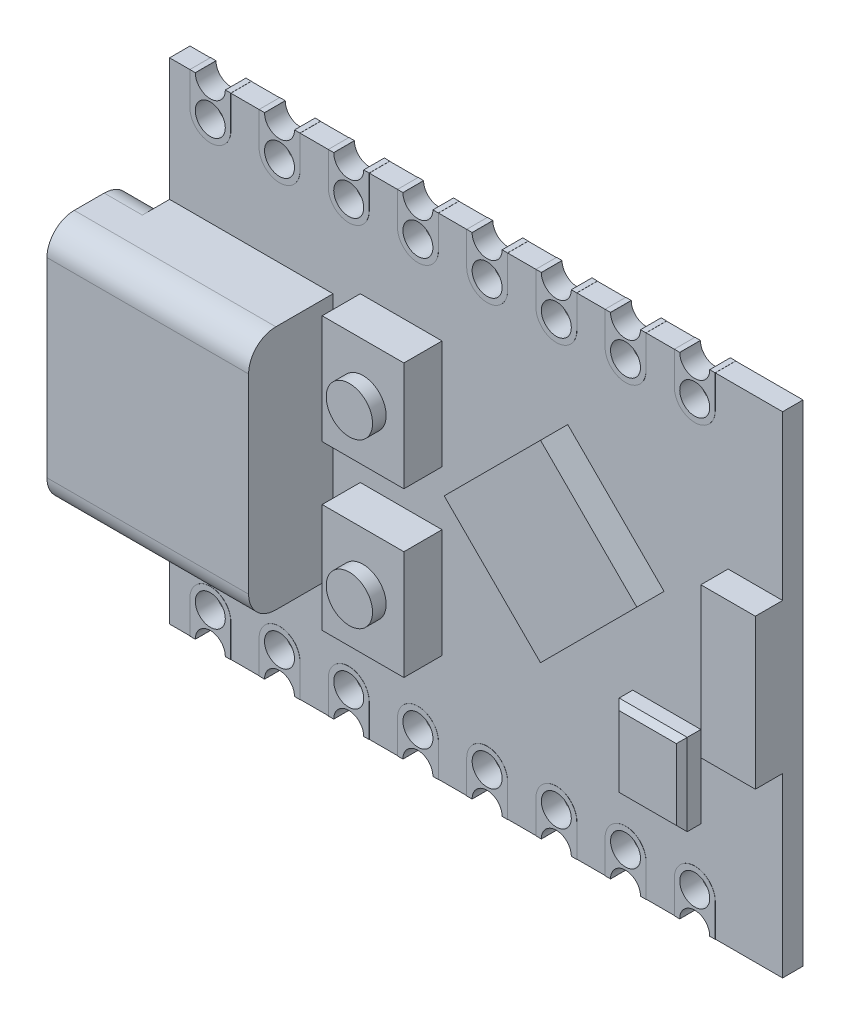
from build123d import *
from build123d.topology import SkipClean

# Parameters (mm, degrees)
ESBO_O1_W                     = 22.5
ESBO_O1_H                     = 18
PCI_DEPTH                     = 0.75
ESP32_DEPTH                   = 1
ESBO_O3_W                     = 7.4
ESBO_O3_H                     = 9
USB_C_DEPTH                   = 3.1
ARREDONDAMENTO_INFERIOR_USB_R = 1
ARREDONDAMENTO_SUPERIOR_USB_R = 1
FURO_USB_DEPTH                = 3.1
CONEXAOUSB_REACH              = 32.667
CONEXAOUSB_START              = -0.5
ESBO_O9_W                     = 0.75
ESBO_O9_H                     = 7.2
ESBO_O10_R                    = 0.55
FUROSPCB_DEPTH                = 0.75
PADS_START                    = 0.005
ESBO_O11_R                    = 0.55
PADS_DEPTH                    = 0.005
ESBO_O13_R                    = 0.55
INFERIORPADS_DEPTH            = 0.005
ESBO_O14_W                    = 0.2
ESBO_O14_H                    = 0.76
PADEX_DEPTH                   = 0.005
ESBO_O16_W                    = 0.2
ESBO_O16_H                    = 0.76
PADEX1_DEPTH                  = 0.005
ESBO_O17_W                    = 2
ESBO_O17_H                    = 5.5
ANTENA_DEPTH                  = 1
ESBO_O18_W                    = 3
ESBO_O18_H                    = 4
BUTTONS_DEPTH                 = 1.4
ESBO_O19_R                    = 0.85
RESSALTO_EXTRUS_O12_DEPTH     = 0.5
ESBO_O20_W                    = 2.5
ESBO_O20_H                    = 3
RESSALTO_EXTRUS_O13_DEPTH     = 0.7
CHANFRO1_SIZE                 = 0.2


with BuildPart() as part:
    # Esboço1 → PCI (new body)
    with BuildSketch(Plane.XY):
        with Locations((-11.25, 9)):
            Rectangle(ESBO_O1_W, ESBO_O1_H)
    extrude(amount=PCI_DEPTH)

    # Esboço2 → ESP32 (add)
    with BuildSketch(Plane.XY.offset(0.75)):
        Polygon((-11.421067812, 10.114466094), (-7.885533906, 13.65), (-4.35, 10.114466094), (-7.885533906, 6.578932188), align=None)
    extrude(amount=ESP32_DEPTH)

    # Esboço3 → USB-C (add)
    with BuildSketch(Plane.XY.offset(0.75)):
        with Locations((-20.2, 9)):
            Rectangle(ESBO_O3_W, ESBO_O3_H)
    extrude(amount=USB_C_DEPTH)

    # Arredondamento inferior USB
    arredondamento_inferior_usb_edges = [part.edges().sort_by_distance(p)[0] for p in [
        (-23.2, 13.5, 0.75),
        (-23.2, 4.5, 0.75),
    ]]
    fillet(arredondamento_inferior_usb_edges, radius=ARREDONDAMENTO_INFERIOR_USB_R)

    # Arredondamento Superior USB
    arredondamento_superior_usb_edges = [part.edges().sort_by_distance(p)[0] for p in [
        (-20.2, 13.5, 3.85),
        (-20.2, 4.5, 3.85),
    ]]
    fillet(arredondamento_superior_usb_edges, radius=ARREDONDAMENTO_SUPERIOR_USB_R)

    # Esboço8 → Furo USB (cut)
    with BuildSketch(Plane.ZY.offset(23.9)):
        with BuildLine():
            Line((1.05, 12.5), (1.05, 5.5))
            ThreePointArc((1.05, 5.5), (1.255025253, 5.005025253), (1.75, 4.8))
            Line((1.75, 4.8), (2.85, 4.8))
            ThreePointArc((2.85, 4.8), (3.344974747, 5.005025253), (3.55, 5.5))
            Line((3.55, 5.5), (3.55, 12.5))
            ThreePointArc((3.55, 12.5), (3.344974747, 12.994974747), (2.85, 13.2))
            Line((2.85, 13.2), (1.75, 13.2))
            ThreePointArc((1.75, 13.2), (1.255025253, 12.994974747), (1.05, 12.5))
        make_face()
    extrude(amount=-FURO_USB_DEPTH, mode=Mode.SUBTRACT)

    # Esboço9 → ConexaoUSB (add, up to next)
    with BuildSketch(Plane.ZY.offset(23.9).offset(CONEXAOUSB_START), mode=Mode.PRIVATE) as conexaousb_sk1:
        with Locations((2.3, 9)):
            Rectangle(ESBO_O9_W, ESBO_O9_H)
    conexaousb_tool1 = extrude(conexaousb_sk1.sketch, amount=-CONEXAOUSB_REACH, mode=Mode.PRIVATE) - part.part
    add(conexaousb_tool1.solids().sort_by_distance((-23.4, 9, 2.3))[0])

    # Esboço10 → FurosPCB (cut)
    with BuildSketch(Plane.XY.offset(0.75)):
        with Locations((-21, 1.2)):
            Circle(ESBO_O10_R)
        with Locations((-21, 0)):
            Circle(ESBO_O10_R)
        with Locations((-18.46, 1.2)):
            Circle(ESBO_O10_R)
        with Locations((-18.46, 0)):
            Circle(ESBO_O10_R)
        with Locations((-15.92, 1.2)):
            Circle(ESBO_O10_R)
        with Locations((-15.92, 0)):
            Circle(ESBO_O10_R)
        with Locations((-13.38, 1.2)):
            Circle(ESBO_O10_R)
        with Locations((-13.38, 0)):
            Circle(ESBO_O10_R)
        with Locations((-10.84, 1.2)):
            Circle(ESBO_O10_R)
        with Locations((-10.84, 0)):
            Circle(ESBO_O10_R)
        with Locations((-8.3, 1.2)):
            Circle(ESBO_O10_R)
        with Locations((-8.3, 0)):
            Circle(ESBO_O10_R)
        with Locations((-5.76, 1.2)):
            Circle(ESBO_O10_R)
        with Locations((-5.76, 0)):
            Circle(ESBO_O10_R)
        with Locations((-3.22, 1.2)):
            Circle(ESBO_O10_R)
        with Locations((-3.22, 0)):
            Circle(ESBO_O10_R)
        with Locations((-3.22, 18)):
            Circle(ESBO_O10_R)
        with Locations((-3.22, 16.8)):
            Circle(ESBO_O10_R)
        with Locations((-5.76, 18)):
            Circle(ESBO_O10_R)
        with Locations((-5.76, 16.8)):
            Circle(ESBO_O10_R)
        with Locations((-8.3, 18)):
            Circle(ESBO_O10_R)
        with Locations((-8.3, 16.8)):
            Circle(ESBO_O10_R)
        with Locations((-10.84, 18)):
            Circle(ESBO_O10_R)
        with Locations((-10.84, 16.8)):
            Circle(ESBO_O10_R)
        with Locations((-13.38, 18)):
            Circle(ESBO_O10_R)
        with Locations((-13.38, 16.8)):
            Circle(ESBO_O10_R)
        with Locations((-15.92, 18)):
            Circle(ESBO_O10_R)
        with Locations((-15.92, 16.8)):
            Circle(ESBO_O10_R)
        with Locations((-18.46, 18)):
            Circle(ESBO_O10_R)
        with Locations((-18.46, 16.8)):
            Circle(ESBO_O10_R)
        with Locations((-21, 18)):
            Circle(ESBO_O10_R)
        with Locations((-21, 16.8)):
            Circle(ESBO_O10_R)
    extrude(amount=-FUROSPCB_DEPTH, mode=Mode.SUBTRACT)

    # Esboço11 → PADs (add)
    # profile 1 of 16: a face of its own
    with BuildSketch(Plane.XY.offset(0.75).offset(PADS_START)):
        with BuildLine():
            Line((-21.75, 1.2), (-21.75, 0))
            Line((-21.75, 0), (-21.55, 0))
            ThreePointArc((-21.55, 0), (-21, 0.55), (-20.45, 0))
            Line((-20.45, 0), (-20.25, 0))
            Line((-20.25, 0), (-20.25, 1.2))
            ThreePointArc((-20.25, 1.2), (-21, 1.95), (-21.75, 1.2))
        make_face()
        with Locations((-21, 1.2)):
            Circle(ESBO_O11_R, mode=Mode.SUBTRACT)
    # profile 2 of 16: a face of its own
    with BuildSketch(Plane.XY.offset(0.75).offset(PADS_START)):
        with BuildLine():
            Line((-17.71, 1.2), (-17.71, 0))
            Line((-17.71, 0), (-17.91, 0))
            ThreePointArc((-17.91, 0), (-18.46, 0.55), (-19.01, 0))
            Line((-19.01, 0), (-19.21, 0))
            Line((-19.21, 0), (-19.21, 1.2))
            ThreePointArc((-19.21, 1.2), (-18.46, 1.95), (-17.71, 1.2))
        make_face()
        with Locations((-18.46, 1.2)):
            Circle(ESBO_O11_R, mode=Mode.SUBTRACT)
    # profile 3 of 16: a face of its own
    with BuildSketch(Plane.XY.offset(0.75).offset(PADS_START)):
        with BuildLine():
            Line((-15.17, 1.2), (-15.17, 0))
            Line((-15.17, 0), (-15.37, 0))
            ThreePointArc((-15.37, 0), (-15.92, 0.55), (-16.47, 0))
            Line((-16.47, 0), (-16.67, 0))
            Line((-16.67, 0), (-16.67, 1.2))
            ThreePointArc((-16.67, 1.2), (-15.92, 1.95), (-15.17, 1.2))
        make_face()
        with Locations((-15.92, 1.2)):
            Circle(ESBO_O11_R, mode=Mode.SUBTRACT)
    # profile 4 of 16: a face of its own
    with BuildSketch(Plane.XY.offset(0.75).offset(PADS_START)):
        with BuildLine():
            Line((-12.63, 1.2), (-12.63, 0))
            Line((-12.63, 0), (-12.83, 0))
            ThreePointArc((-12.83, 0), (-13.38, 0.55), (-13.93, 0))
            Line((-13.93, 0), (-14.13, 0))
            Line((-14.13, 0), (-14.13, 1.2))
            ThreePointArc((-14.13, 1.2), (-13.38, 1.95), (-12.63, 1.2))
        make_face()
        with Locations((-13.38, 1.2)):
            Circle(ESBO_O11_R, mode=Mode.SUBTRACT)
    # profile 5 of 16: a face of its own
    with BuildSketch(Plane.XY.offset(0.75).offset(PADS_START)):
        with BuildLine():
            Line((-10.09, 1.2), (-10.09, 0))
            Line((-10.09, 0), (-10.29, 0))
            ThreePointArc((-10.29, 0), (-10.84, 0.55), (-11.39, 0))
            Line((-11.39, 0), (-11.59, 0))
            Line((-11.59, 0), (-11.59, 1.2))
            ThreePointArc((-11.59, 1.2), (-10.84, 1.95), (-10.09, 1.2))
        make_face()
        with Locations((-10.84, 1.2)):
            Circle(ESBO_O11_R, mode=Mode.SUBTRACT)
    # profile 6 of 16: a face of its own
    with BuildSketch(Plane.XY.offset(0.75).offset(PADS_START)):
        with BuildLine():
            Line((-7.55, 1.2), (-7.55, 0))
            Line((-7.55, 0), (-7.75, 0))
            ThreePointArc((-7.75, 0), (-8.3, 0.55), (-8.85, 0))
            Line((-8.85, 0), (-9.05, 0))
            Line((-9.05, 0), (-9.05, 1.2))
            ThreePointArc((-9.05, 1.2), (-8.3, 1.95), (-7.55, 1.2))
        make_face()
        with Locations((-8.3, 1.2)):
            Circle(ESBO_O11_R, mode=Mode.SUBTRACT)
    # profile 7 of 16: a face of its own
    with BuildSketch(Plane.XY.offset(0.75).offset(PADS_START)):
        with BuildLine():
            Line((-5.01, 1.2), (-5.01, 0))
            Line((-5.01, 0), (-5.21, 0))
            ThreePointArc((-5.21, 0), (-5.76, 0.55), (-6.31, 0))
            Line((-6.31, 0), (-6.51, 0))
            Line((-6.51, 0), (-6.51, 1.2))
            ThreePointArc((-6.51, 1.2), (-5.76, 1.95), (-5.01, 1.2))
        make_face()
        with Locations((-5.76, 1.2)):
            Circle(ESBO_O11_R, mode=Mode.SUBTRACT)
    # profile 8 of 16: a face of its own
    with BuildSketch(Plane.XY.offset(0.75).offset(PADS_START)):
        with BuildLine():
            Line((-2.47, 1.2), (-2.47, 0))
            Line((-2.47, 0), (-2.67, 0))
            ThreePointArc((-2.67, 0), (-3.22, 0.55), (-3.77, 0))
            Line((-3.77, 0), (-3.97, 0))
            Line((-3.97, 0), (-3.97, 1.2))
            ThreePointArc((-3.97, 1.2), (-3.22, 1.95), (-2.47, 1.2))
        make_face()
        with Locations((-3.22, 1.2)):
            Circle(ESBO_O11_R, mode=Mode.SUBTRACT)
    # profile 9 of 16: a face of its own
    with BuildSketch(Plane.XY.offset(0.75).offset(PADS_START)):
        with BuildLine():
            Line((-3.97, 18), (-3.77, 18))
            ThreePointArc((-3.77, 18), (-3.22, 17.45), (-2.67, 18))
            Line((-2.67, 18), (-2.47, 18))
            Line((-2.47, 18), (-2.47, 16.8))
            ThreePointArc((-2.47, 16.8), (-3.22, 16.05), (-3.97, 16.8))
            Line((-3.97, 16.8), (-3.97, 18))
        make_face()
        with Locations((-3.22, 16.8)):
            Circle(ESBO_O11_R, mode=Mode.SUBTRACT)
    # profile 10 of 16: a face of its own
    with BuildSketch(Plane.XY.offset(0.75).offset(PADS_START)):
        with BuildLine():
            Line((-6.51, 18), (-6.31, 18))
            ThreePointArc((-6.31, 18), (-5.76, 17.45), (-5.21, 18))
            Line((-5.21, 18), (-5.01, 18))
            Line((-5.01, 18), (-5.01, 16.8))
            ThreePointArc((-5.01, 16.8), (-5.76, 16.05), (-6.51, 16.8))
            Line((-6.51, 16.8), (-6.51, 18))
        make_face()
        with Locations((-5.76, 16.8)):
            Circle(ESBO_O11_R, mode=Mode.SUBTRACT)
    # profile 11 of 16: a face of its own
    with BuildSketch(Plane.XY.offset(0.75).offset(PADS_START)):
        with BuildLine():
            Line((-9.05, 18), (-8.85, 18))
            ThreePointArc((-8.85, 18), (-8.3, 17.45), (-7.75, 18))
            Line((-7.75, 18), (-7.55, 18))
            Line((-7.55, 18), (-7.55, 16.8))
            ThreePointArc((-7.55, 16.8), (-8.3, 16.05), (-9.05, 16.8))
            Line((-9.05, 16.8), (-9.05, 18))
        make_face()
        with Locations((-8.3, 16.8)):
            Circle(ESBO_O11_R, mode=Mode.SUBTRACT)
    # profile 12 of 16: a face of its own
    with BuildSketch(Plane.XY.offset(0.75).offset(PADS_START)):
        with BuildLine():
            Line((-11.59, 18), (-11.39, 18))
            ThreePointArc((-11.39, 18), (-10.84, 17.45), (-10.29, 18))
            Line((-10.29, 18), (-10.09, 18))
            Line((-10.09, 18), (-10.09, 16.8))
            ThreePointArc((-10.09, 16.8), (-10.84, 16.05), (-11.59, 16.8))
            Line((-11.59, 16.8), (-11.59, 18))
        make_face()
        with Locations((-10.84, 16.8)):
            Circle(ESBO_O11_R, mode=Mode.SUBTRACT)
    # profile 13 of 16: a face of its own
    with BuildSketch(Plane.XY.offset(0.75).offset(PADS_START)):
        with BuildLine():
            Line((-14.13, 18), (-13.93, 18))
            ThreePointArc((-13.93, 18), (-13.38, 17.45), (-12.83, 18))
            Line((-12.83, 18), (-12.63, 18))
            Line((-12.63, 18), (-12.63, 16.8))
            ThreePointArc((-12.63, 16.8), (-13.38, 16.05), (-14.13, 16.8))
            Line((-14.13, 16.8), (-14.13, 18))
        make_face()
        with Locations((-13.38, 16.8)):
            Circle(ESBO_O11_R, mode=Mode.SUBTRACT)
    # profile 14 of 16: a face of its own
    with BuildSketch(Plane.XY.offset(0.75).offset(PADS_START)):
        with BuildLine():
            Line((-16.67, 18), (-16.47, 18))
            ThreePointArc((-16.47, 18), (-15.92, 17.45), (-15.37, 18))
            Line((-15.37, 18), (-15.17, 18))
            Line((-15.17, 18), (-15.17, 16.8))
            ThreePointArc((-15.17, 16.8), (-15.92, 16.05), (-16.67, 16.8))
            Line((-16.67, 16.8), (-16.67, 18))
        make_face()
        with Locations((-15.92, 16.8)):
            Circle(ESBO_O11_R, mode=Mode.SUBTRACT)
    # profile 15 of 16: a face of its own
    with BuildSketch(Plane.XY.offset(0.75).offset(PADS_START)):
        with BuildLine():
            Line((-19.21, 18), (-19.01, 18))
            ThreePointArc((-19.01, 18), (-18.46, 17.45), (-17.91, 18))
            Line((-17.91, 18), (-17.71, 18))
            Line((-17.71, 18), (-17.71, 16.8))
            ThreePointArc((-17.71, 16.8), (-18.46, 16.05), (-19.21, 16.8))
            Line((-19.21, 16.8), (-19.21, 18))
        make_face()
        with Locations((-18.46, 16.8)):
            Circle(ESBO_O11_R, mode=Mode.SUBTRACT)
    # profile 16 of 16: a face of its own
    with BuildSketch(Plane.XY.offset(0.75).offset(PADS_START)):
        with BuildLine():
            Line((-20.45, 18), (-20.25, 18))
            Line((-20.25, 18), (-20.25, 16.8))
            ThreePointArc((-20.25, 16.8), (-21, 16.05), (-21.75, 16.8))
            Line((-21.75, 16.8), (-21.75, 18))
            Line((-21.75, 18), (-21.55, 18))
            ThreePointArc((-21.55, 18), (-21, 17.45), (-20.45, 18))
        make_face()
        with Locations((-21, 16.8)):
            Circle(ESBO_O11_R, mode=Mode.SUBTRACT)
    extrude(amount=-PADS_DEPTH)

    # Esboço13 → InferiorPads (add)
    # profile 1 of 16: a face of its own
    with SkipClean():  # the faces are left unmerged after this step: merging them gives an invalid solid
        with BuildSketch(Plane(origin=(0, 0, 0), x_dir=(-1, 0, 0), z_dir=(0, 0, -1))):
            with BuildLine():
                Line((21.75, 0), (21.55, 0))
                ThreePointArc((21.55, 0), (21, 0.55), (20.45, 0))
                Line((20.45, 0), (20.25, 0))
                Line((20.25, 0), (20.25, 1.2))
                ThreePointArc((20.25, 1.2), (21, 1.95), (21.75, 1.2))
                Line((21.75, 1.2), (21.75, 0))
            make_face()
            with Locations(Location((21, 1.2, 0), (0, 0, 180))):
                Circle(ESBO_O13_R, mode=Mode.SUBTRACT)
        # profile 2 of 16: a face of its own
        with BuildSketch(Plane(origin=(0, 0, 0), x_dir=(-1, 0, 0), z_dir=(0, 0, -1))):
            with BuildLine():
                Line((19.21, 1.2), (19.21, 0))
                Line((19.21, 0), (19.01, 0))
                ThreePointArc((19.01, 0), (18.46, 0.55), (17.91, 0))
                Line((17.91, 0), (17.71, 0))
                Line((17.71, 0), (17.71, 1.2))
                ThreePointArc((17.71, 1.2), (18.46, 1.95), (19.21, 1.2))
            make_face()
            with Locations(Location((18.46, 1.2, 0), (0, 0, 180))):
                Circle(ESBO_O13_R, mode=Mode.SUBTRACT)
        # profile 3 of 16: a face of its own
        with BuildSketch(Plane(origin=(0, 0, 0), x_dir=(-1, 0, 0), z_dir=(0, 0, -1))):
            with BuildLine():
                Line((16.67, 1.2), (16.67, 0))
                Line((16.67, 0), (16.47, 0))
                ThreePointArc((16.47, 0), (15.92, 0.55), (15.37, 0))
                Line((15.37, 0), (15.17, 0))
                Line((15.17, 0), (15.17, 1.2))
                ThreePointArc((15.17, 1.2), (15.92, 1.95), (16.67, 1.2))
            make_face()
            with Locations(Location((15.92, 1.2, 0), (0, 0, 180))):
                Circle(ESBO_O13_R, mode=Mode.SUBTRACT)
        # profile 4 of 16: a face of its own
        with BuildSketch(Plane(origin=(0, 0, 0), x_dir=(-1, 0, 0), z_dir=(0, 0, -1))):
            with BuildLine():
                Line((14.13, 1.2), (14.13, 0))
                Line((14.13, 0), (13.93, 0))
                ThreePointArc((13.93, 0), (13.38, 0.55), (12.83, 0))
                Line((12.83, 0), (12.63, 0))
                Line((12.63, 0), (12.63, 1.2))
                ThreePointArc((12.63, 1.2), (13.38, 1.95), (14.13, 1.2))
            make_face()
            with Locations(Location((13.38, 1.2, 0), (0, 0, 180))):
                Circle(ESBO_O13_R, mode=Mode.SUBTRACT)
        # profile 5 of 16: a face of its own
        with BuildSketch(Plane(origin=(0, 0, 0), x_dir=(-1, 0, 0), z_dir=(0, 0, -1))):
            with BuildLine():
                Line((11.59, 1.2), (11.59, 0))
                Line((11.59, 0), (11.39, 0))
                ThreePointArc((11.39, 0), (10.84, 0.55), (10.29, 0))
                Line((10.29, 0), (10.09, 0))
                Line((10.09, 0), (10.09, 1.2))
                ThreePointArc((10.09, 1.2), (10.84, 1.95), (11.59, 1.2))
            make_face()
            with Locations(Location((10.84, 1.2, 0), (0, 0, 180))):
                Circle(ESBO_O13_R, mode=Mode.SUBTRACT)
        # profile 6 of 16: a face of its own
        with BuildSketch(Plane(origin=(0, 0, 0), x_dir=(-1, 0, 0), z_dir=(0, 0, -1))):
            with BuildLine():
                Line((9.05, 1.2), (9.05, 0))
                Line((9.05, 0), (8.85, 0))
                ThreePointArc((8.85, 0), (8.3, 0.55), (7.75, 0))
                Line((7.75, 0), (7.55, 0))
                Line((7.55, 0), (7.55, 1.2))
                ThreePointArc((7.55, 1.2), (8.3, 1.95), (9.05, 1.2))
            make_face()
            with Locations(Location((8.3, 1.2, 0), (0, 0, 180))):
                Circle(ESBO_O13_R, mode=Mode.SUBTRACT)
        # profile 7 of 16: a face of its own
        with BuildSketch(Plane(origin=(0, 0, 0), x_dir=(-1, 0, 0), z_dir=(0, 0, -1))):
            with BuildLine():
                Line((6.51, 1.2), (6.51, 0))
                Line((6.51, 0), (6.31, 0))
                ThreePointArc((6.31, 0), (5.76, 0.55), (5.21, 0))
                Line((5.21, 0), (5.01, 0))
                Line((5.01, 0), (5.01, 1.2))
                ThreePointArc((5.01, 1.2), (5.76, 1.95), (6.51, 1.2))
            make_face()
            with Locations(Location((5.76, 1.2, 0), (0, 0, 180))):
                Circle(ESBO_O13_R, mode=Mode.SUBTRACT)
        # profile 8 of 16: a face of its own
        with BuildSketch(Plane(origin=(0, 0, 0), x_dir=(-1, 0, 0), z_dir=(0, 0, -1))):
            with BuildLine():
                Line((3.97, 1.2), (3.97, 0))
                Line((3.97, 0), (3.77, 0))
                ThreePointArc((3.77, 0), (3.22, 0.55), (2.67, 0))
                Line((2.67, 0), (2.47, 0))
                Line((2.47, 0), (2.47, 1.2))
                ThreePointArc((2.47, 1.2), (3.22, 1.95), (3.97, 1.2))
            make_face()
            with Locations(Location((3.22, 1.2, 0), (0, 0, 180))):
                Circle(ESBO_O13_R, mode=Mode.SUBTRACT)
        # profile 9 of 16: a face of its own
        with BuildSketch(Plane(origin=(0, 0, 0), x_dir=(-1, 0, 0), z_dir=(0, 0, -1))):
            with BuildLine():
                Line((2.47, 16.8), (2.47, 18))
                Line((2.47, 18), (2.67, 18))
                ThreePointArc((2.67, 18), (3.22, 17.45), (3.77, 18))
                Line((3.77, 18), (3.97, 18))
                Line((3.97, 18), (3.97, 16.8))
                ThreePointArc((3.97, 16.8), (3.22, 16.05), (2.47, 16.8))
            make_face()
            with Locations(Location((3.22, 16.8, 0), (0, 0, 180))):
                Circle(ESBO_O13_R, mode=Mode.SUBTRACT)
        # profile 10 of 16: a face of its own
        with BuildSketch(Plane(origin=(0, 0, 0), x_dir=(-1, 0, 0), z_dir=(0, 0, -1))):
            with BuildLine():
                Line((5.01, 16.8), (5.01, 18))
                Line((5.01, 18), (5.21, 18))
                ThreePointArc((5.21, 18), (5.76, 17.45), (6.31, 18))
                Line((6.31, 18), (6.51, 18))
                Line((6.51, 18), (6.51, 16.8))
                ThreePointArc((6.51, 16.8), (5.76, 16.05), (5.01, 16.8))
            make_face()
            with Locations(Location((5.76, 16.8, 0), (0, 0, 180))):
                Circle(ESBO_O13_R, mode=Mode.SUBTRACT)
        # profile 11 of 16: a face of its own
        with BuildSketch(Plane(origin=(0, 0, 0), x_dir=(-1, 0, 0), z_dir=(0, 0, -1))):
            with BuildLine():
                Line((7.55, 16.8), (7.55, 18))
                Line((7.55, 18), (7.75, 18))
                ThreePointArc((7.75, 18), (8.3, 17.45), (8.85, 18))
                Line((8.85, 18), (9.05, 18))
                Line((9.05, 18), (9.05, 16.8))
                ThreePointArc((9.05, 16.8), (8.3, 16.05), (7.55, 16.8))
            make_face()
            with Locations(Location((8.3, 16.8, 0), (0, 0, 180))):
                Circle(ESBO_O13_R, mode=Mode.SUBTRACT)
        # profile 12 of 16: a face of its own
        with BuildSketch(Plane(origin=(0, 0, 0), x_dir=(-1, 0, 0), z_dir=(0, 0, -1))):
            with BuildLine():
                Line((10.09, 16.8), (10.09, 18))
                Line((10.09, 18), (10.29, 18))
                ThreePointArc((10.29, 18), (10.84, 17.45), (11.39, 18))
                Line((11.39, 18), (11.59, 18))
                Line((11.59, 18), (11.59, 16.8))
                ThreePointArc((11.59, 16.8), (10.84, 16.05), (10.09, 16.8))
            make_face()
            with Locations(Location((10.84, 16.8, 0), (0, 0, 180))):
                Circle(ESBO_O13_R, mode=Mode.SUBTRACT)
        # profile 13 of 16: a face of its own
        with BuildSketch(Plane(origin=(0, 0, 0), x_dir=(-1, 0, 0), z_dir=(0, 0, -1))):
            with BuildLine():
                Line((12.63, 16.8), (12.63, 18))
                Line((12.63, 18), (12.83, 18))
                ThreePointArc((12.83, 18), (13.38, 17.45), (13.93, 18))
                Line((13.93, 18), (14.13, 18))
                Line((14.13, 18), (14.13, 16.8))
                ThreePointArc((14.13, 16.8), (13.38, 16.05), (12.63, 16.8))
            make_face()
            with Locations(Location((13.38, 16.8, 0), (0, 0, 180))):
                Circle(ESBO_O13_R, mode=Mode.SUBTRACT)
        # profile 14 of 16: a face of its own
        with BuildSketch(Plane(origin=(0, 0, 0), x_dir=(-1, 0, 0), z_dir=(0, 0, -1))):
            with BuildLine():
                Line((15.17, 16.8), (15.17, 18))
                Line((15.17, 18), (15.37, 18))
                ThreePointArc((15.37, 18), (15.92, 17.45), (16.47, 18))
                Line((16.47, 18), (16.67, 18))
                Line((16.67, 18), (16.67, 16.8))
                ThreePointArc((16.67, 16.8), (15.92, 16.05), (15.17, 16.8))
            make_face()
            with Locations(Location((15.92, 16.8, 0), (0, 0, 180))):
                Circle(ESBO_O13_R, mode=Mode.SUBTRACT)
        # profile 15 of 16: a face of its own
        with BuildSketch(Plane(origin=(0, 0, 0), x_dir=(-1, 0, 0), z_dir=(0, 0, -1))):
            with BuildLine():
                Line((17.71, 16.8), (17.71, 18))
                Line((17.71, 18), (17.91, 18))
                ThreePointArc((17.91, 18), (18.46, 17.45), (19.01, 18))
                Line((19.01, 18), (19.21, 18))
                Line((19.21, 18), (19.21, 16.8))
                ThreePointArc((19.21, 16.8), (18.46, 16.05), (17.71, 16.8))
            make_face()
            with Locations(Location((18.46, 16.8, 0), (0, 0, 180))):
                Circle(ESBO_O13_R, mode=Mode.SUBTRACT)
        # profile 16 of 16: a face of its own
        with BuildSketch(Plane(origin=(0, 0, 0), x_dir=(-1, 0, 0), z_dir=(0, 0, -1))):
            with BuildLine():
                Line((21.75, 16.8), (21.75, 18))
                Line((21.75, 18), (21.55, 18))
                ThreePointArc((21.55, 18), (21, 17.45), (20.45, 18))
                Line((20.45, 18), (20.25, 18))
                Line((20.25, 18), (20.25, 16.8))
                ThreePointArc((20.25, 16.8), (21, 16.05), (21.75, 16.8))
            make_face()
            with Locations(Location((21, 16.8, 0), (0, 0, 180))):
                Circle(ESBO_O13_R, mode=Mode.SUBTRACT)
        extrude(amount=INFERIORPADS_DEPTH)
    add(part.part.scale(1), mode=Mode.REPLACE)  # the faces are merged on a copy

    # Esboço14 → PADEx (add)
    with BuildSketch(Plane(origin=(0, 18, 0), x_dir=(1, 0, 0), z_dir=(0, 1, 0))):
        with Locations((-21.65, -0.375)):
            Rectangle(ESBO_O14_W, ESBO_O14_H)
        Polygon((-20.45, 0.005), (-20.25, 0), (-20.25, -0.755), (-20.45, -0.755), align=None)
        with Locations((-19.11, -0.375)):
            Rectangle(ESBO_O14_W, ESBO_O14_H)
        Polygon((-17.91, -0.755), (-17.91, 0.005), (-17.71, 0), (-17.71, -0.755), align=None)
        with Locations((-16.57, -0.375)):
            Rectangle(ESBO_O14_W, ESBO_O14_H)
        Polygon((-15.37, -0.755), (-15.37, 0.005), (-15.17, 0), (-15.17, -0.755), align=None)
        with Locations((-14.03, -0.375)):
            Rectangle(ESBO_O14_W, ESBO_O14_H)
        Polygon((-12.83, -0.755), (-12.83, 0.005), (-12.63, 0), (-12.63, -0.755), align=None)
        with Locations((-11.49, -0.375)):
            Rectangle(ESBO_O14_W, ESBO_O14_H)
        Polygon((-10.29, -0.755), (-10.29, 0.005), (-10.09, 0), (-10.09, -0.755), align=None)
        with Locations((-8.95, -0.375)):
            Rectangle(ESBO_O14_W, ESBO_O14_H)
        Polygon((-7.75, -0.755), (-7.75, 0.005), (-7.55, 0), (-7.55, -0.755), align=None)
        with Locations((-6.41, -0.375)):
            Rectangle(ESBO_O14_W, ESBO_O14_H)
        Polygon((-5.21, -0.755), (-5.21, 0.005), (-5.01, 0), (-5.01, -0.755), align=None)
        with Locations((-3.87, -0.375)):
            Rectangle(ESBO_O14_W, ESBO_O14_H)
        Polygon((-2.67, -0.755), (-2.67, 0.005), (-2.47, 0), (-2.47, -0.755), align=None)
    extrude(amount=PADEX_DEPTH)

    # Esboço16 → PADEx1 (add)
    with BuildSketch(Plane.XZ):
        with Locations((-21.65, 0.375)):
            Rectangle(ESBO_O16_W, ESBO_O16_H)
        with Locations((-20.35, 0.375)):
            Rectangle(ESBO_O16_W, ESBO_O16_H)
        with Locations((-17.81, 0.375)):
            Rectangle(ESBO_O16_W, ESBO_O16_H)
        with Locations((-19.11, 0.375)):
            Rectangle(ESBO_O16_W, ESBO_O16_H)
        with Locations((-15.27, 0.375)):
            Rectangle(ESBO_O16_W, ESBO_O16_H)
        with Locations((-16.57, 0.375)):
            Rectangle(ESBO_O16_W, ESBO_O16_H)
        with Locations((-12.73, 0.375)):
            Rectangle(ESBO_O16_W, ESBO_O16_H)
        with Locations((-14.03, 0.375)):
            Rectangle(ESBO_O16_W, ESBO_O16_H)
        with Locations((-10.19, 0.375)):
            Rectangle(ESBO_O16_W, ESBO_O16_H)
        with Locations((-11.49, 0.375)):
            Rectangle(ESBO_O16_W, ESBO_O16_H)
        with Locations((-7.65, 0.375)):
            Rectangle(ESBO_O16_W, ESBO_O16_H)
        with Locations((-8.95, 0.375)):
            Rectangle(ESBO_O16_W, ESBO_O16_H)
        with Locations((-5.11, 0.375)):
            Rectangle(ESBO_O16_W, ESBO_O16_H)
        with Locations((-6.41, 0.375)):
            Rectangle(ESBO_O16_W, ESBO_O16_H)
        with Locations((-2.57, 0.375)):
            Rectangle(ESBO_O16_W, ESBO_O16_H)
        with Locations((-3.87, 0.375)):
            Rectangle(ESBO_O16_W, ESBO_O16_H)
    extrude(amount=PADEX1_DEPTH)

    # Esboço17 → Antena (add)
    with BuildSketch(Plane.XY.offset(0.75)):
        with Locations((-1, 9.25)):
            Rectangle(ESBO_O17_W, ESBO_O17_H)
    extrude(amount=ANTENA_DEPTH)

    # Esboço18 → Buttons (add)
    with BuildSketch(Plane.XY.offset(0.75)):
        with Locations((-14, 12)):
            Rectangle(ESBO_O18_W, ESBO_O18_H)
        with Locations((-14, 6)):
            Rectangle(ESBO_O18_W, ESBO_O18_H)
    extrude(amount=BUTTONS_DEPTH)

    # Esboço19 → Ressalto-extrusão12 (add)
    with BuildSketch(Plane.XY.offset(2.15)):
        with Locations((-14, 6)):
            Circle(ESBO_O19_R)
        with Locations((-14, 12)):
            Circle(ESBO_O19_R)
    extrude(amount=RESSALTO_EXTRUS_O12_DEPTH)

    # Esboço20 → Ressalto-extrusão13 (add)
    with BuildSketch(Plane.XY.offset(0.75)):
        with Locations((-4.25, 4.9)):
            Rectangle(ESBO_O20_W, ESBO_O20_H)
    extrude(amount=RESSALTO_EXTRUS_O13_DEPTH)

    # Chanfro1
    chanfro1_edges = [part.edges().sort_by_distance(p)[0] for p in [
        (-5.5, 4.9, 1.45),
        (-4.25, 3.4, 1.45),
        (-3, 4.9, 1.45),
        (-4.25, 6.4, 1.45),
    ]]
    chamfer(chanfro1_edges, length=CHANFRO1_SIZE)


solid = part.part
